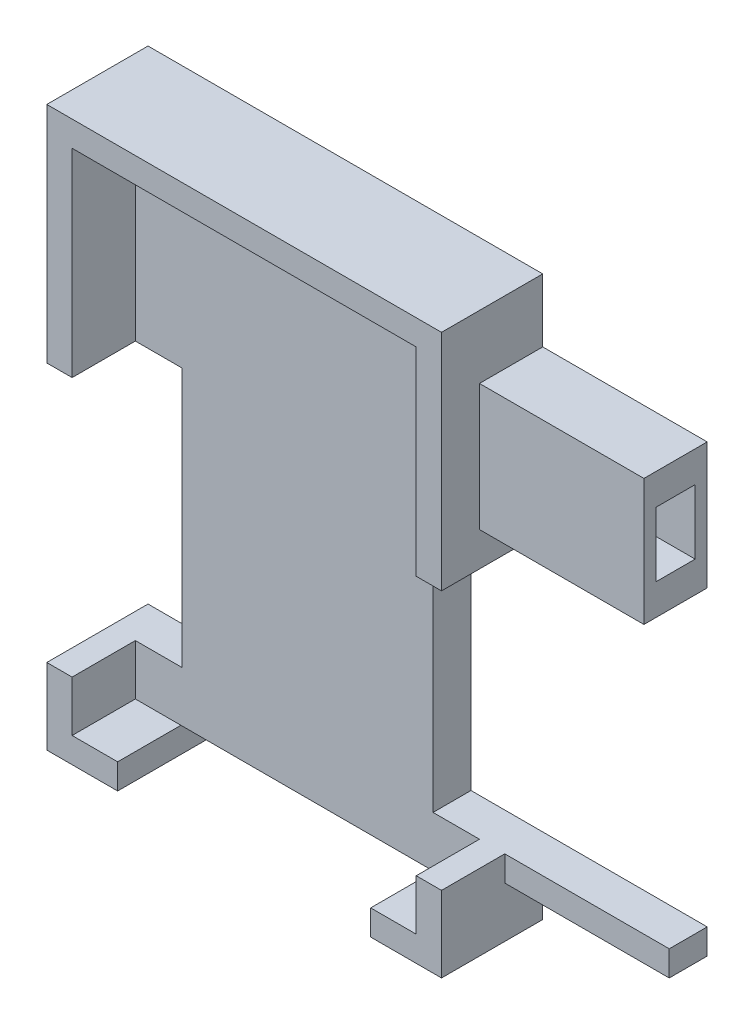
from build123d import *

# Parameters (mm, degrees)
BOSS_EXTRUDE1_DEPTH = 3
BOSS_EXTRUDE2_DEPTH = 5
SKETCH1_4_W         = 13
SKETCH1_4_H         = 10
BOSS_EXTRUDE3_DEPTH = 5
SKETCH2_W           = 3.1
SKETCH2_H           = 5.1
CUT_EXTRUDE1_DEPTH  = 6
BOSS_EXTRUDE4_DEPTH = 8
SKETCH3_W           = 13
SKETCH3_H           = 2
BOSS_EXTRUDE5_DEPTH = 3


with BuildPart() as part:
    # Sketch1 → Boss-Extrude1 (new body)
    with BuildSketch(Plane.XY):
        Polygon((9.93, 4.4), (13.6, 4.4), (13.6, 20.1), (-13.6, 20.1), (-13.6, 4.4), (-9.93, 4.4), (-9.93, -16.1), (-13.6, -16.1), (-13.6, -20.1), (-10, -20.1), (10, -20.1), (13.6, -20.1), (13.6, -16.1), (9.93, -16.1), align=None)
    extrude(amount=BOSS_EXTRUDE1_DEPTH)

    # Sketch1<3> → Boss-Extrude2 (add)
    with BuildSketch(Plane.XY):
        Polygon((15.6, 4.4), (15.6, 22.1), (-15.6, 22.1), (-15.6, 4.4), (-13.6, 4.4), (-13.6, 20.1), (13.6, 20.1), (13.6, 4.4), align=None)
        Polygon((15.6, -22.1), (15.6, -16.1), (13.6, -16.1), (13.6, -20.1), (10, -20.1), (10, -22.1), align=None)
        Polygon((-13.6, -16.1), (-15.6, -16.1), (-15.6, -22.1), (-10, -22.1), (-10, -20.1), (-13.6, -20.1), align=None)
    extrude(amount=BOSS_EXTRUDE2_DEPTH)

    # Sketch1<4> → Boss-Extrude3 (add)
    with BuildSketch(Plane.XY):
        with Locations((22.1, 12.1)):
            Rectangle(SKETCH1_4_W, SKETCH1_4_H)
    extrude(amount=BOSS_EXTRUDE3_DEPTH)

    # Sketch2 → Cut-Extrude1 (cut)
    with BuildSketch(Plane(origin=(28.6, 0, 0), x_dir=(0, 0, -1), z_dir=(1, 0, 0))):
        with Locations((-2.5, 12.1)):
            Rectangle(SKETCH2_W, SKETCH2_H)
    extrude(amount=-CUT_EXTRUDE1_DEPTH, mode=Mode.SUBTRACT)

    # Sketch1<5> → Boss-Extrude4 (add)
    with BuildSketch(Plane.XY):
        Polygon((15.6, 4.4), (15.6, 22.1), (-15.6, 22.1), (-15.6, 4.4), (-13.6, 4.4), (-13.6, 20.1), (13.6, 20.1), (13.6, 4.4), align=None)
        Polygon((15.6, -22.1), (15.6, -16.1), (13.6, -16.1), (13.6, -20.1), (10, -20.1), (10, -22.1), align=None)
        Polygon((-13.6, -16.1), (-15.6, -16.1), (-15.6, -22.1), (-10, -22.1), (-10, -20.1), (-13.6, -20.1), align=None)
    extrude(amount=BOSS_EXTRUDE4_DEPTH)

    # Sketch3 → Boss-Extrude5 (add)
    with BuildSketch(Plane(origin=(0, 0, 0), x_dir=(-1, 0, 0), z_dir=(0, 0, -1))):
        with Locations((-22.1, -17.1)):
            Rectangle(SKETCH3_W, SKETCH3_H)
    extrude(amount=-BOSS_EXTRUDE5_DEPTH)


solid = part.part
